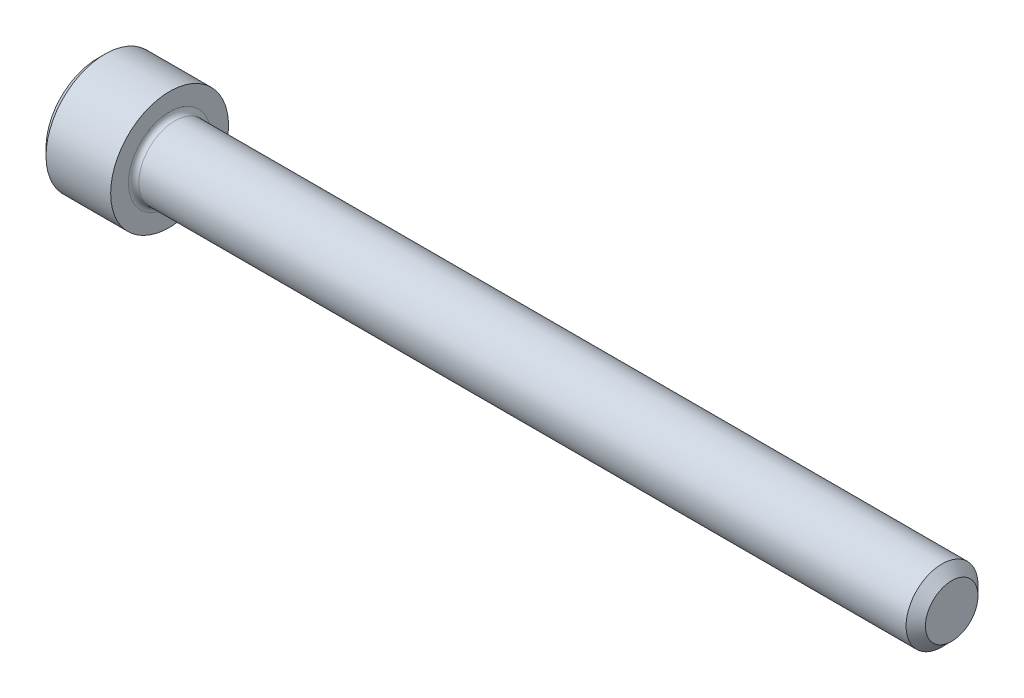
from build123d import *

# Parameters (mm, degrees)
FILLET1_R   = 0.254
HEX_2_DEPTH = 1.6256


with BuildPart() as part:
    # BodySke → Base-Revolve (revolve)
    with BuildSketch(Plane.XY):
        Polygon((0, 0), (0, 2.5146), (0.3556, 2.8702), (3.5052, 2.8702), (3.5052, 1.7526), (41.13276, 1.7526), (41.6052, 1.28016), (41.6052, 0), align=None)
    revolve(axis=Axis((-31.75, 0, 0), (1, 0, 0)))

    # Fillet1
    fillet1_edges = [part.edges().sort_by_distance(p)[0] for p in [
        (3.5052, -1.7526, 0),
    ]]
    fillet(fillet1_edges, radius=FILLET1_R)

    # Sketch2 → Hex-PreBroach (revolve, cut)
    with BuildSketch(Plane.XY):
        Polygon((0, 1.3843), (1.6256, 1.3843), (2.424825978, 0), (0, 0), align=None)
    revolve(axis=Axis((0, 0, 0), (1, 0, 0)), mode=Mode.SUBTRACT)

    # Sketch3 → Hex 2 (cut)
    with BuildSketch(Plane(origin=(0, 0, 0), x_dir=(0, 0.500000000000001, 0.866025403784438), z_dir=(-1, 0, 0))):
        Polygon((0.799225978, 1.3843), (-0.799225978, 1.3843), (-1.598451955, 0), (-0.799225978, -1.3843), (0.799225978, -1.3843), (1.598451955, 0), align=None)
    extrude(amount=-HEX_2_DEPTH, mode=Mode.SUBTRACT)


solid = part.part
